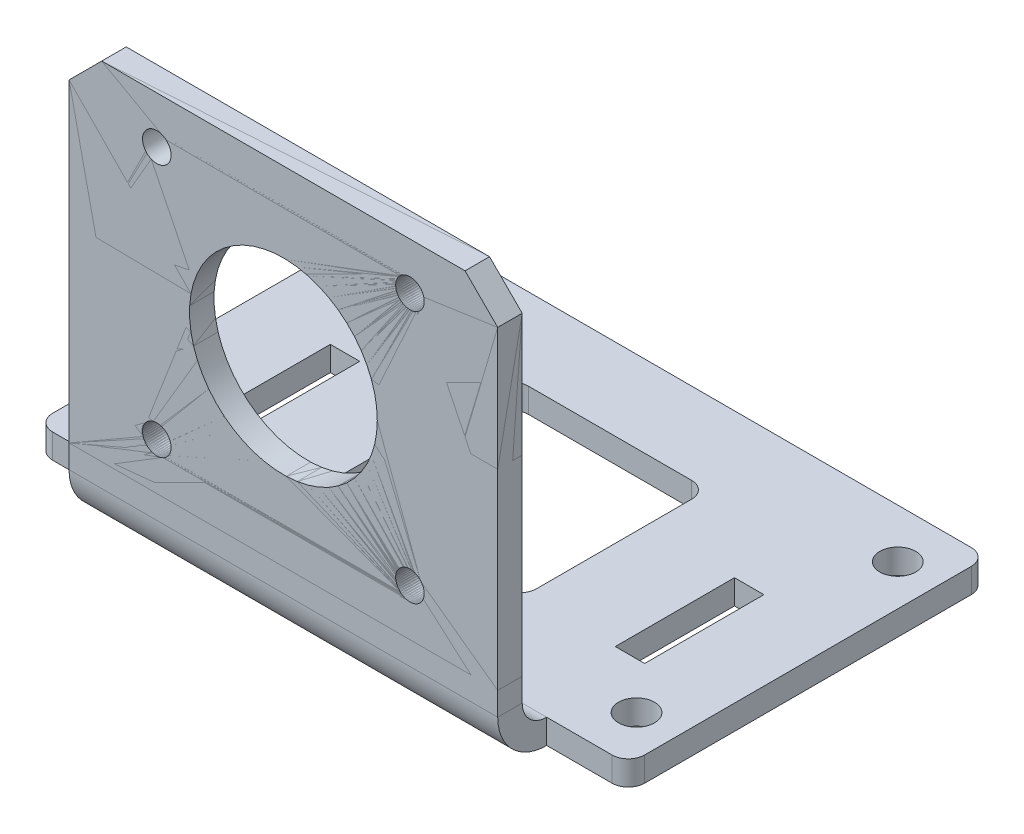
from build123d import *

# Parameters (mm, degrees)
SKETCH1_W                    = 52.5
SKETCH1_H                    = 42.5
SKETCH1_R                    = 11.5
BOSS_EXTRUDE1_DEPTH          = 3
CHAMFER1_SIZE                = 4
CUT_EXTRUDE1_REACH           = 35.906
SKETCH3_R                    = 1.75
CIRPATTERN1_COUNT            = 4
CONVERT_SOLID1_OUTLINE_R     = 1.75
CONVERT_SOLID1_OUTLINE_R_2   = 11.5
CONVERT_SOLID1_DEPTH         = 3
SKETCH4_W                    = 52.5
SKETCH4_H                    = 5.85
BASE_FLANGE1_DEPTH           = 3
EDGE_FLANGE1_STRIP_W         = 18
EDGE_FLANGE1_STRIP_H         = 3
EDGE_FLANGE1_STRIP_CUT_DEPTH = 52.5
EDGE_FLANGE1_DEPTH           = 52.5
SKETCH15_W                   = 24
SKETCH15_H                   = 23
CUT_EXTRUDE2_DEPTH           = 3
FILLET3_R                    = 2
SKETCH12_W                   = 10
SKETCH12_H                   = 44
SKETCH12_R                   = 2.2
TAB1_DEPTH                   = 3
FILLET1_R                    = 2
FILLET1_OF_MIRROR1_R         = 2
SKETCH16_W                   = 3.6
SKETCH16_H                   = 14.6
CUT_EXTRUDE3_DEPTH           = 10
SKETCH17_W                   = 3.6
SKETCH17_H                   = 14.6
CUT_EXTRUDE4_DEPTH           = 3


# Read off the part's stored shape, not the designer's step: Convert-Solid1
# Sheet-metal steps are written as plain solids
with BuildPart() as part:
    # Sketch1 → Boss-Extrude1 (new body)
    with BuildSketch(Plane.XY):
        Rectangle(SKETCH1_W, SKETCH1_H)
        Circle(SKETCH1_R, mode=Mode.SUBTRACT)
    extrude(amount=BOSS_EXTRUDE1_DEPTH)

    # Chamfer1
    chamfer1_edges = [part.edges().sort_by_distance(p)[0] for p in [
        (-26.25, 21.25, 1.5),
        (26.25, 21.25, 1.5),
    ]]
    chamfer(chamfer1_edges, length=CHAMFER1_SIZE)

    # Sketch3 → Cut-Extrude1 (cut, up to next)
    with BuildSketch(Plane.XY.offset(3), mode=Mode.PRIVATE) as cut_extrude1_sk1:
        with Locations((-15.5, 15.5)):
            Circle(SKETCH3_R)
    cut_extrude1_tool1 = extrude(cut_extrude1_sk1.sketch, amount=-CUT_EXTRUDE1_REACH, mode=Mode.PRIVATE) & part.part
    cut_extrude1 = cut_extrude1_tool1.solids().sort_by_distance((-15.5, 15.5, 3))[0]
    add(cut_extrude1, mode=Mode.SUBTRACT)

    # CirPattern1: Cut-Extrude1 ×4 about axis
    cirpattern1_axis = Axis((0, 0, 0), (0, 0, 1))
    for i in range(1, CIRPATTERN1_COUNT):
        add(cut_extrude1.rotate(cirpattern1_axis, i * 360 / CIRPATTERN1_COUNT), mode=Mode.SUBTRACT)


with BuildPart() as body_2:
    # Convert-Solid1 outline → Convert-Solid1 (new body)
    with BuildSketch(Plane.XY):
        Polygon((-22.25, 21.25), (-26.25, 17.25), (-26.25, -21.25), (26.25, -21.25), (26.25, 17.25), (22.25, 21.25), align=None)
        with Locations((-15.5, -15.5)):
            Circle(CONVERT_SOLID1_OUTLINE_R, mode=Mode.SUBTRACT)
        with Locations((15.5, -15.5)):
            Circle(CONVERT_SOLID1_OUTLINE_R, mode=Mode.SUBTRACT)
        with Locations((-15.5, 15.5)):
            Circle(CONVERT_SOLID1_OUTLINE_R, mode=Mode.SUBTRACT)
        Circle(CONVERT_SOLID1_OUTLINE_R_2, mode=Mode.SUBTRACT)
        with Locations((15.5, 15.5)):
            Circle(CONVERT_SOLID1_OUTLINE_R, mode=Mode.SUBTRACT)
    extrude(amount=CONVERT_SOLID1_DEPTH)


with BuildPart() as body_3:
    # Sketch4 → Base-Flange1 (new body)
    with BuildSketch(Plane(origin=(0, 0, 0), x_dir=(-1, 0, 0), z_dir=(0, 0, -1))):
        with Locations((0, -24.175)):
            Rectangle(SKETCH4_W, SKETCH4_H)
    extrude(amount=-BASE_FLANGE1_DEPTH)

    # Combine1: union body 2
    add(body_2.part)

    # Edge-Flange1 strip (across the edge) → Edge-Flange1 strip cut (cut)
    with BuildSketch(Plane(origin=(26.25, -27.1, 0), x_dir=(0, 1, 0), z_dir=(-1, 0, 0))):
        with Locations((-6, -1.5)):
            Rectangle(EDGE_FLANGE1_STRIP_W, EDGE_FLANGE1_STRIP_H)
    extrude(amount=EDGE_FLANGE1_STRIP_CUT_DEPTH, mode=Mode.SUBTRACT)

    # Edge-Flange1 section (across the edge) → Edge-Flange1 (add)
    with BuildSketch(Plane(origin=(26.25, -27.1, 0), x_dir=(0, 1, 0), z_dir=(-1, 0, 0))):
        with BuildLine():
            Line((-3, 3), (-3, 47))
            Line((-3, 47), (0, 47))
            Line((0, 47), (0, 3))
            ThreePointArc((0, 3), (0.878679656, 0.878679656), (3, 0))
            Line((3, 0), (3, -3))
            ThreePointArc((3, -3), (-1.242640687, -1.242640687), (-3, 3))
        make_face()
    extrude(amount=EDGE_FLANGE1_DEPTH)

    # Sketch15 → Cut-Extrude2 (cut)
    with BuildSketch(Plane(origin=(0, -27.1, 0), x_dir=(1, 0, 0), z_dir=(0, 1, 0))):
        with Locations((0, 25.5)):
            Rectangle(SKETCH15_W, SKETCH15_H)
    extrude(amount=-CUT_EXTRUDE2_DEPTH, mode=Mode.SUBTRACT)

    # Fillet3
    fillet3_edges = [body_3.edges().sort_by_distance(p)[0] for p in [
        (-12, -28.6, -14),
        (-12, -28.6, -37),
        (12, -28.6, -37),
        (12, -28.6, -14),
    ]]
    fillet(fillet3_edges, radius=FILLET3_R)

    # Sketch12 → Tab1 (add)
    with BuildSketch(Plane(origin=(0, -27.1, 0), x_dir=(1, 0, 0), z_dir=(0, 1, 0))):
        with Locations((31.25, 25)):
            Rectangle(SKETCH12_W, SKETCH12_H)
        with Locations(Location((31.25, 41, 0), (0, 0, 270))):
            Circle(SKETCH12_R, mode=Mode.SUBTRACT)
        with Locations(Location((31.25, 9, 0), (0, 0, 90))):
            Circle(SKETCH12_R, mode=Mode.SUBTRACT)
    tab1 = extrude(amount=-TAB1_DEPTH)

    # Fillet1
    fillet1_edges = [body_3.edges().sort_by_distance(p)[0] for p in [
        (36.25, -28.6, -47),
        (36.25, -28.6, -3),
    ]]
    fillet(fillet1_edges, radius=FILLET1_R)

    # Mirror1: Tab1 across plane
    add(tab1.mirror(Plane(origin=(0, 0, 0), x_dir=(0, 0, 1), z_dir=(1, 0, 0))))

    # Fillet1 of Mirror1
    fillet1_of_mirror1_edges = [body_3.edges().sort_by_distance(p)[0] for p in [
        (-36.25, -28.6, -47),
        (-36.25, -28.6, -3),
    ]]
    fillet(fillet1_of_mirror1_edges, radius=FILLET1_OF_MIRROR1_R)

    # Sketch16 → Cut-Extrude3 (cut)
    with BuildSketch(Plane.XY.offset(3)):
        with Locations((24.75, -5.1)):
            Rectangle(SKETCH16_W, SKETCH16_H)
    cut_extrude3 = extrude(amount=-CUT_EXTRUDE3_DEPTH, mode=Mode.SUBTRACT)

    # Mirror2: Cut-Extrude3 across plane
    add(cut_extrude3.mirror(Plane(origin=(0, 0, 0), x_dir=(0, 0, 1), z_dir=(1, 0, 0))), mode=Mode.SUBTRACT)

    # Sketch17 → Cut-Extrude4 (cut)
    with BuildSketch(Plane.XZ.offset(30.1)):
        with Locations((24.75, -22)):
            Rectangle(SKETCH17_W, SKETCH17_H)
    cut_extrude4 = extrude(amount=-CUT_EXTRUDE4_DEPTH, mode=Mode.SUBTRACT)

    # Mirror3: Cut-Extrude4 across plane
    add(cut_extrude4.mirror(Plane(origin=(0, 0, 0), x_dir=(0, 0, 1), z_dir=(1, 0, 0))), mode=Mode.SUBTRACT)


solid = Compound([part.part, body_3.part])
